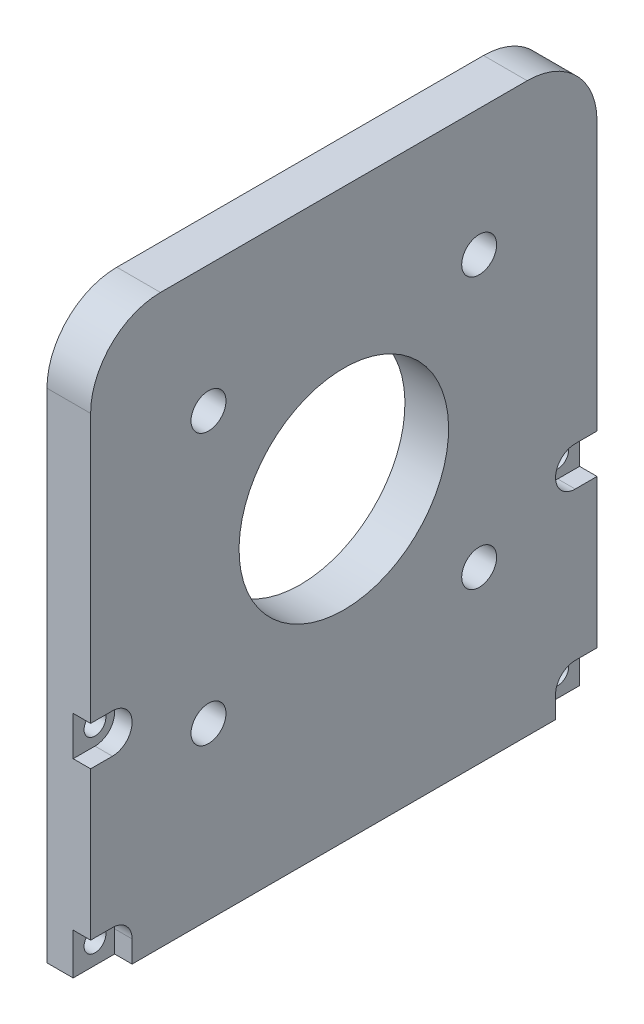
from build123d import *

# Parameters (mm, degrees)
RESSALTO_EXTRUS_O1_DEPTH  = 29
CORTE_EXTRUS_O1_REACH     = 115.6
ESBO_O2_R                 = 6.5
ESBO_O3_R                 = 18
CORTE_EXTRUS_O2_DEPTH     = 2.5
CORTE_EXTRUS_O3_START     = -5
ESBO_O5_R                 = 2
ESBO_O5_R_2               = 1.5
CORTE_EXTRUS_O3_DEPTH     = 5
ESBO_O7_R                 = 12
ESBO_O7_R_2               = 2
CORTE_EXTRUS_O4_DEPTH     = 110.590145542
ESBO_O11_W                = 18
ESBO_O11_H                = 10
RESSALTO_EXTRUS_O3_DEPTH  = 8
ESBO_O12_W                = 14.4
ESBO_O12_H                = 6.8
CORTE_EXTRUS_O6_DEPTH     = 3
ESBO_O13_W                = 13.4
ESBO_O13_H                = 5.8
CORTE_EXTRUS_O7_DEPTH     = 5
CORTE_EXTRUS_O8_REACH     = 84.898
RESSALTO_EXTRUS_O4_DEPTH  = 5
ESBO_O17_W                = 2.6
ESBO_O17_H                = 10
RESSALTO_EXTRUS_O5_DEPTH  = 8
CHANFRO1_SIZE             = 5
FILETE1_R                 = 8
ESBO_O18_W                = 20
ESBO_O18_H                = 8
RESSALTO_EXTRUS_O6_DEPTH  = 13
ESBO_O19_R                = 2.25
CORTE_EXTRUS_O9_DEPTH     = 80.252760204
CHANFRO2_SIZE             = 3
CHANFRO2_SIZE_2           = 13
CORTE_EXTRUS_O10_START    = -6
CORTE_EXTRUS_O10_DEPTH    = 74.252760204
ESBO_O21_W                = 26
ESBO_O21_H                = 16
RESSALTO_EXTRUS_O7_DEPTH  = 30
CORTE_EXTRUS_O11_DEPTH    = 26
ESBO_O24_R                = 1
ESBO_O24_W                = 17.2
ESBO_O24_H                = 3
RESSALTO_EXTRUS_O8_DEPTH  = 3
ESBO_O25_W                = 11.2
ESBO_O25_H                = 4
CORTE_EXTRUS_O12_DEPTH    = 2
ESBO_O26_R                = 3.5
CORTE_EXTRUS_O13_DEPTH    = 96.289033997
ESBO_O27_W                = 24
ESBO_O27_H                = 8
RESSALTO_EXTRUS_O9_DEPTH  = 6
ESBO_O28_W                = 1.5
ESBO_O28_H                = 8
RESSALTO_EXTRUS_O10_DEPTH = 2
ESBO_O31_R                = 1
CORTE_EXTRUS_O14_DEPTH    = 85.172442046
ESBO_O32_R                = 1
CORTE_EXTRUS_O15_DEPTH    = 12
ESBO_O33_R                = 1.25
CORTE_EXTRUS_O16_DEPTH    = 5
CORTE_EXTRUS_O17_DEPTH    = 2
ESBO_O36_R                = 71.402948567
CORTE_EXTRUS_O18_DEPTH    = 114.723348526


with BuildPart() as part:
    # Esboço1 → Ressalto-extrusão1 (new, symmetric)
    with BuildSketch(Plane.XY):
        Polygon((0, 0), (-41, 0), (-41, 60), (-46, 60), (-46, -5), (46, -5), (46, 60), (41, 60), (41, 0), align=None)
    extrude(amount=RESSALTO_EXTRUS_O1_DEPTH, both=True)

    # Esboço2 → Corte-extrusão1 (cut, up to next)
    with BuildSketch(Plane.ZY.offset(46), mode=Mode.PRIVATE) as corte_extrus_o1_sk1:
        with Locations(Location((0, 30, 0), (0, 0, 270))):
            Circle(ESBO_O2_R)
    corte_extrus_o1_tool1 = extrude(corte_extrus_o1_sk1.sketch, amount=-CORTE_EXTRUS_O1_REACH, mode=Mode.PRIVATE) & part.part
    add(corte_extrus_o1_tool1.solids().sort_by_distance((-46, 30, 0))[0], mode=Mode.SUBTRACT)

    # Esboço3 → Corte-extrusão2 (cut)
    with BuildSketch(Plane.ZY.offset(46)):
        with Locations(Location((0, 30, 0), (0, 0, 270))):
            Circle(ESBO_O3_R)
    extrude(amount=-CORTE_EXTRUS_O2_DEPTH, mode=Mode.SUBTRACT)

    # Esboço5 → Corte-extrusão3 (cut)
    with BuildSketch(Plane.ZY.offset(46).offset(CORTE_EXTRUS_O3_START)):
        with Locations(Location((-15.5, 45.5, 0), (0, 0, 270))):
            Circle(ESBO_O5_R)
        with Locations(Location((0, 42, 0), (0, 0, 270))):
            Circle(ESBO_O5_R_2)
        with Locations(Location((0, 18, 0), (0, 0, 270))):
            Circle(ESBO_O5_R_2)
        with Locations(Location((0, 54, 0), (0, 0, 270))):
            Circle(ESBO_O5_R)
        with Locations(Location((15.5, 45.5, 0), (0, 0, 270))):
            Circle(ESBO_O5_R)
        with Locations(Location((15.5, 14.5, 0), (0, 0, 270))):
            Circle(ESBO_O5_R)
        with Locations(Location((-15.5, 14.5, 0), (0, 0, 270))):
            Circle(ESBO_O5_R)
        with Locations(Location((20.784609691, 18, 0), (0, 0, 270))):
            Circle(ESBO_O5_R)
        with Locations(Location((-20.784609691, 18, 0), (0, 0, 270))):
            Circle(ESBO_O5_R)
        with BuildLine():
            Line((-8, 31.5), (8, 31.5))
            ThreePointArc((8, 31.5), (9.5, 30), (8, 28.5))
            Line((8, 28.5), (-8, 28.5))
            ThreePointArc((-8, 28.5), (-9.5, 30), (-8, 31.5))
        make_face()
    extrude(amount=CORTE_EXTRUS_O3_DEPTH, mode=Mode.SUBTRACT)

    # Esboço7 → Corte-extrusão4 (cut, through all)
    with BuildSketch(Plane.ZY.offset(-41)):
        with Locations(Location((0, 30, 0), (0, 0, 270))):
            Circle(ESBO_O7_R)
        with Locations(Location((-15.5, 45.5, 0), (0, 0, 270))):
            Circle(ESBO_O7_R_2)
        with Locations(Location((15.5, 45.5, 0), (0, 0, 270))):
            Circle(ESBO_O7_R_2)
        with Locations(Location((15.5, 14.5, 0), (0, 0, 270))):
            Circle(ESBO_O7_R_2)
        with Locations(Location((-15.5, 14.5, 0), (0, 0, 270))):
            Circle(ESBO_O7_R_2)
    extrude(amount=-CORTE_EXTRUS_O4_DEPTH, mode=Mode.SUBTRACT)

    # Esboço11 → Ressalto-extrusão3 (add)
    with BuildSketch(Plane(origin=(0, 0, 0), x_dir=(1, 0, 0), z_dir=(0, 1, 0))):
        with Locations((-29.4, 0)):
            Rectangle(ESBO_O11_W, ESBO_O11_H)
    extrude(amount=RESSALTO_EXTRUS_O3_DEPTH)

    # Esboço12 → Corte-extrusão6 (cut)
    with BuildSketch(Plane(origin=(0, 8, 0), x_dir=(1, 0, 0), z_dir=(0, 1, 0))):
        with Locations((-29.4, 0)):
            Rectangle(ESBO_O12_W, ESBO_O12_H)
    extrude(amount=-CORTE_EXTRUS_O6_DEPTH, mode=Mode.SUBTRACT)

    # Esboço13 → Corte-extrusão7 (cut)
    with BuildSketch(Plane(origin=(0, 5, 0), x_dir=(1, 0, 0), z_dir=(0, 1, 0))):
        with Locations((-29.4, 0)):
            Rectangle(ESBO_O13_W, ESBO_O13_H)
    extrude(amount=-CORTE_EXTRUS_O7_DEPTH, mode=Mode.SUBTRACT)

    # Esboço14 → Corte-extrusão8 (cut, up to next)
    with BuildSketch(Plane.XY.offset(5), mode=Mode.PRIVATE) as corte_extrus_o8_sk1:
        with BuildLine():
            Line((-33.4, 0), (-25.4, 0))
            ThreePointArc((-25.4, 0), (-29.4, 4), (-33.4, 0))
        make_face()
    corte_extrus_o8_tool1 = extrude(corte_extrus_o8_sk1.sketch, amount=-CORTE_EXTRUS_O8_REACH, mode=Mode.PRIVATE) & part.part
    add(corte_extrus_o8_tool1.solids().sort_by_distance((-29.4, 1.697653, 5))[0], mode=Mode.SUBTRACT)

    # Esboço16 → Ressalto-extrusão4 (add)
    with BuildSketch(Plane.XY.offset(29)):
        Polygon((-41, 32), (-21, 12), (21, 12), (41, 32), (41, 0), (-41, 0), align=None)
    ressalto_extrus_o4 = extrude(amount=-RESSALTO_EXTRUS_O4_DEPTH)

    # Espelhar1: Ressalto-extrusão4 across plane
    add(ressalto_extrus_o4.mirror(Plane.XY))

    # Esboço17 → Ressalto-extrusão5 (add)
    with BuildSketch(Plane(origin=(0, 8, 0), x_dir=(1, 0, 0), z_dir=(0, 1, 0))):
        with Locations((-39.7, 0)):
            Rectangle(ESBO_O17_W, ESBO_O17_H)
    extrude(amount=-RESSALTO_EXTRUS_O5_DEPTH)

    # Chanfro1
    chanfro1_edges = [part.edges().sort_by_distance(p)[0] for p in [
        (41, 0, 0),
        (-41, 0, 14.5),
        (-41, 0, -14.5),
    ]]
    chamfer(chanfro1_edges, length=CHANFRO1_SIZE)

    # Filete1
    filete1_edges = [part.edges().sort_by_distance(p)[0] for p in [
        (-43.5, 60, -29),
        (-43.5, 60, 29),
        (-41, 32, 26.5),
        (-21, 12, 26.5),
        (21, 12, 26.5),
        (41, 32, 26.5),
        (-41, 32, -26.5),
        (41, 32, -26.5),
        (21, 12, -26.5),
        (-21, 12, -26.5),
        (43.5, 60, 29),
        (43.5, 60, -29),
    ]]
    fillet(filete1_edges, radius=FILETE1_R)

    # Esboço18 → Ressalto-extrusão6 (add)
    with BuildSketch(Plane.XY.offset(29)):
        with Locations((22, 7)):
            Rectangle(ESBO_O18_W, ESBO_O18_H)
    extrude(amount=RESSALTO_EXTRUS_O6_DEPTH)

    # Esboço19 → Corte-extrusão9 (cut, through all)
    with BuildSketch(Plane(origin=(0, 11, 0), x_dir=(1, 0, 0), z_dir=(0, 1, 0))):
        with Locations(Location((18, -35.75, 0), (0, 0, 270))):
            Circle(ESBO_O19_R)
        with Locations(Location((26, -35.75, 0), (0, 0, 270))):
            Circle(ESBO_O19_R)
    extrude(amount=-CORTE_EXTRUS_O9_DEPTH, mode=Mode.SUBTRACT)

    # Chanfro2
    # the kernel refuses this chamfer: 13, 3 mm, written as the material it adds along each edge
    with BuildSketch(Plane(origin=(12, 3, 29), x_dir=(0, -0.987043568605235, -0.1604524654688814), z_dir=(1, 0, 0))) as chanfro2_piece_1_section:
        Polygon((CHANFRO2_SIZE * 0.987043568605, -CHANFRO2_SIZE * 0.160452465469), (-CHANFRO2_SIZE_2 * 0.160452465469, -CHANFRO2_SIZE_2 * 0.987043568605), (0, 0), align=None)
    chanfro2_piece_1 = extrude(amount=20, mode=Mode.PRIVATE)
    chanfro2_piece_1 = split(chanfro2_piece_1, bisect_by=Plane(origin=(21.999997786, 2.099377296, 42), z_dir=(0, 0, -1)), keep=Keep.TOP, mode=Mode.PRIVATE)
    chanfro2_piece_1 = chanfro2_piece_1 - Plane(origin=(18, 2.099377296, 35.75), x_dir=(0, 0, 1), z_dir=(0, 1, 0)) * Cylinder(2.25, 92, mode=Mode.PRIVATE)
    chanfro2_piece_1 = chanfro2_piece_1 - Plane(origin=(26, 2.099377296, 35.75), x_dir=(0, 0, 1), z_dir=(0, 1, 0)) * Cylinder(2.25, 92, mode=Mode.PRIVATE)
    add(chanfro2_piece_1)

    # Esboço20 → Corte-extrusão10 (cut, through all)
    with BuildSketch(Plane(origin=(0, 11, 0), x_dir=(1, 0, 0), z_dir=(0, 1, 0)).offset(CORTE_EXTRUS_O10_START)):
        with BuildLine():
            Line((18, -31.5), (26, -31.5))
            ThreePointArc((26, -31.5), (30.25, -35.75), (26, -40))
            Line((26, -40), (18, -40))
            ThreePointArc((18, -40), (13.75, -35.75), (18, -31.5))
        make_face()
    extrude(amount=-CORTE_EXTRUS_O10_DEPTH, mode=Mode.SUBTRACT)

    # Esboço21 → Ressalto-extrusão7 (add)
    with BuildSketch(Plane(origin=(0, 0, 0), x_dir=(1, 0, 0), z_dir=(0, 1, 0))):
        with Locations((-1, 0)):
            Rectangle(ESBO_O21_W, ESBO_O21_H)
    extrude(amount=RESSALTO_EXTRUS_O7_DEPTH)

    # Esboço22 → Corte-extrusão11 (cut)
    with BuildSketch(Plane(origin=(12, 0, 0), x_dir=(0, 0, -1), z_dir=(1, 0, 0))):
        Polygon((6.812733176, 30), (3.406366588, 35.9), (-3.406366588, 35.9), (-6.812733176, 30), (-3.406366588, 24.1), (3.406366588, 24.1), align=None)
    extrude(amount=-CORTE_EXTRUS_O11_DEPTH, mode=Mode.SUBTRACT)

    # Esboço24 → Ressalto-extrusão8 (add)
    # profile 1 of 2: a face of its own
    with BuildSketch(Plane(origin=(0, 0, 0), x_dir=(1, 0, 0), z_dir=(0, 1, 0))):
        with BuildLine():
            Line((17.282291959, 14), (32.482291959, 14))
            ThreePointArc((32.482291959, 14), (34.482291959, 12), (32.482291959, 10))
            Line((32.482291959, 10), (17.282291959, 10))
            ThreePointArc((17.282291959, 10), (15.282291959, 12), (17.282291959, 14))
        make_face()
        with Locations(Location((17.282291959, 12, 0), (0, 0, 180))):
            Circle(ESBO_O24_R, mode=Mode.SUBTRACT)
        with Locations(Location((32.482291959, 12, 0), (0, 0, 180))):
            Circle(ESBO_O24_R, mode=Mode.SUBTRACT)
    # profile 2 of 2: a face of its own
    with BuildSketch(Plane(origin=(0, 0, 0), x_dir=(1, 0, 0), z_dir=(0, 1, 0))):
        with Locations((24.882291959, -8.5)):
            Rectangle(ESBO_O24_W, ESBO_O24_H)
    extrude(amount=RESSALTO_EXTRUS_O8_DEPTH)

    # Esboço25 → Corte-extrusão12 (cut)
    with BuildSketch(Plane(origin=(0, 3, 0), x_dir=(1, 0, 0), z_dir=(0, 1, 0))):
        with Locations((24.882291959, 12)):
            Rectangle(ESBO_O25_W, ESBO_O25_H)
    extrude(amount=-CORTE_EXTRUS_O12_DEPTH, mode=Mode.SUBTRACT)

    # Esboço26 → Corte-extrusão13 (cut, through all)
    with BuildSketch(Plane.XY.offset(29)):
        with Locations((36, 5)):
            Circle(ESBO_O26_R)
    extrude(amount=-CORTE_EXTRUS_O13_DEPTH, mode=Mode.SUBTRACT)

    # Esboço27 → Ressalto-extrusão9 (add)
    with BuildSketch(Plane(origin=(0, 0, 0), x_dir=(1, 0, 0), z_dir=(0, 1, 0))):
        with Locations((-4, 16)):
            Rectangle(ESBO_O27_W, ESBO_O27_H)
    extrude(amount=RESSALTO_EXTRUS_O9_DEPTH)

    # Esboço28 → Ressalto-extrusão10 (add)
    with BuildSketch(Plane(origin=(0, 6, 0), x_dir=(1, 0, 0), z_dir=(0, 1, 0))):
        with Locations((-15.25, 16)):
            Rectangle(ESBO_O28_W, ESBO_O28_H)
        with Locations((7.25, 16)):
            Rectangle(ESBO_O28_W, ESBO_O28_H)
    extrude(amount=RESSALTO_EXTRUS_O10_DEPTH)

    # Esboço31 → Corte-extrusão14 (cut, through all)
    with BuildSketch(Plane.XY.offset(8)):
        with Locations((-10, 22.5)):
            Circle(ESBO_O31_R)
        with Locations((8, 22.5)):
            Circle(ESBO_O31_R)
    extrude(amount=-CORTE_EXTRUS_O14_DEPTH, mode=Mode.SUBTRACT)

    # Esboço32 → Corte-extrusão15 (cut)
    with BuildSketch(Plane.ZY.offset(46)):
        with Locations(Location((-26.5, -2.5, 0), (0, 0, 270))):
            Circle(ESBO_O32_R)
        with Locations(Location((-26.5, 19, 0), (0, 0, 270))):
            Circle(ESBO_O32_R)
        with Locations(Location((26.5, 19, 0), (0, 0, 90))):
            Circle(ESBO_O32_R)
        with Locations(Location((26.5, -2.5, 0), (0, 0, 90))):
            Circle(ESBO_O32_R)
    corte_extrus_o15 = extrude(amount=-CORTE_EXTRUS_O15_DEPTH, mode=Mode.SUBTRACT)

    # Esboço33 → Corte-extrusão16 (cut)
    with BuildSketch(Plane.ZY.offset(46)):
        with Locations(Location((-26.5, -2.5, 0), (0, 0, 270))):
            Circle(ESBO_O33_R)
        with Locations(Location((-26.5, 19, 0), (0, 0, 270))):
            Circle(ESBO_O33_R)
        with Locations(Location((26.5, 19, 0), (0, 0, 90))):
            Circle(ESBO_O33_R)
        with Locations(Location((26.5, -2.5, 0), (0, 0, 90))):
            Circle(ESBO_O33_R)
    corte_extrus_o16 = extrude(amount=-CORTE_EXTRUS_O16_DEPTH, mode=Mode.SUBTRACT)

    # Esboço34 → Corte-extrusão17 (cut)
    with BuildSketch(Plane.ZY.offset(46)):
        with BuildLine():
            Line((-26.5, -0.25), (-29, -0.25))
            Line((-29, -0.25), (-29, -5))
            Line((-29, -5), (-24.25, -5))
            Line((-24.25, -5), (-24.25, -2.5))
            ThreePointArc((-24.25, -2.5), (-24.909009742, -0.909009742), (-26.5, -0.25))
        make_face()
        with BuildLine():
            Line((-26.5, 21.25), (-29, 21.25))
            Line((-29, 21.25), (-29, 16.75))
            Line((-29, 16.75), (-26.5, 16.75))
            ThreePointArc((-26.5, 16.75), (-24.25, 19), (-26.5, 21.25))
        make_face()
        with BuildLine():
            Line((29, 16.75), (29, 21.25))
            Line((29, 21.25), (26.5, 21.25))
            ThreePointArc((26.5, 21.25), (24.25, 19), (26.5, 16.75))
            Line((26.5, 16.75), (29, 16.75))
        make_face()
        with BuildLine():
            Line((29, -5), (24.25, -5))
            Line((24.25, -5), (24.25, -2.5))
            ThreePointArc((24.25, -2.5), (24.909009742, -0.909009742), (26.5, -0.25))
            Line((26.5, -0.25), (29, -0.25))
            Line((29, -0.25), (29, -5))
        make_face()
    corte_extrus_o17 = extrude(amount=-CORTE_EXTRUS_O17_DEPTH, mode=Mode.SUBTRACT)

    # Espelhar2: Corte-extrusão15, Corte-extrusão16, Corte-extrusão17 across plane
    add(corte_extrus_o15.mirror(Plane(origin=(0, 0, 0), x_dir=(0, 0, 1), z_dir=(1, 0, 0))), mode=Mode.SUBTRACT)
    add(corte_extrus_o16.mirror(Plane(origin=(0, 0, 0), x_dir=(0, 0, 1), z_dir=(1, 0, 0))), mode=Mode.SUBTRACT)
    add(corte_extrus_o17.mirror(Plane(origin=(0, 0, 0), x_dir=(0, 0, 1), z_dir=(1, 0, 0))), mode=Mode.SUBTRACT)

    # Esboço36 → Corte-extrusão18 (cut, through all)
    with BuildSketch(Plane.ZY.offset(-41)):
        with Locations((0, 30)):
            Circle(ESBO_O36_R)
    extrude(amount=CORTE_EXTRUS_O18_DEPTH, mode=Mode.SUBTRACT)


solid = part.part
